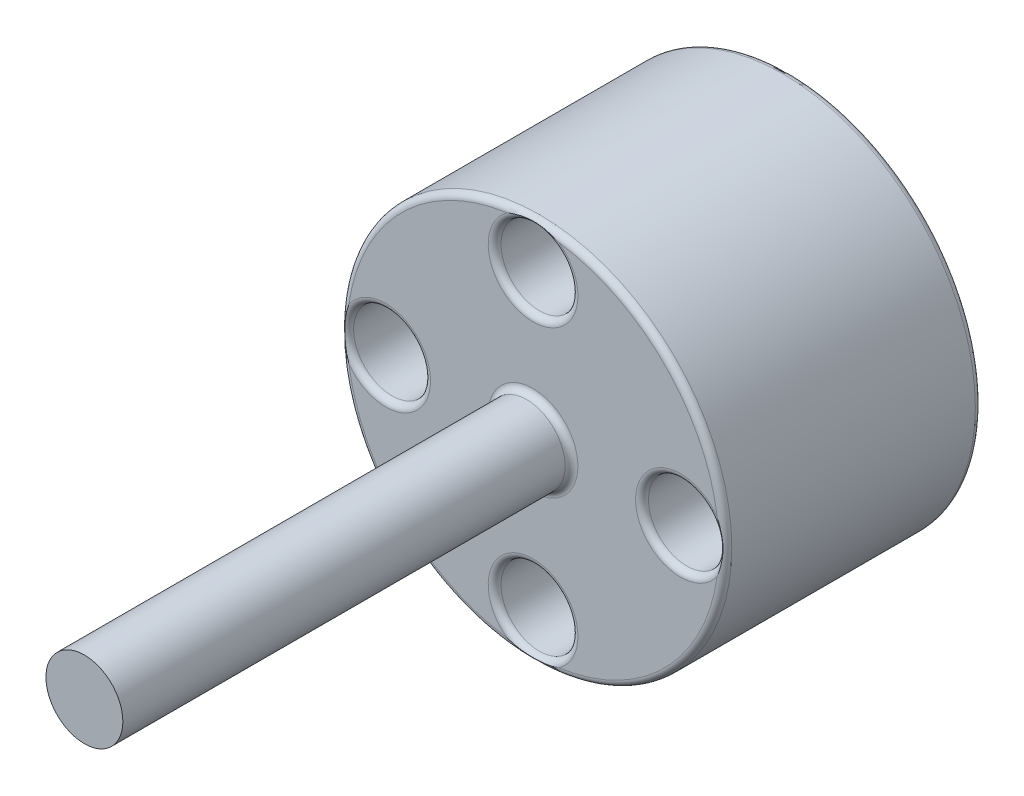
from build123d import *

# Parameters (mm, degrees)
SKETCH1_R                = 1.5
BOSS_EXTRUDE1_DEPTH      = 2
SKETCH3_R                = 0.3
CUT_EXTRUDE2_DEPTH       = 3
BOSS_EXTRUDE2_DEPTH      = 3.5
BOSS_EXTRUDE2_DEPTH_BACK = 2
SKETCH2_R                = 0.3
FILLET1_R                = 0.05


with BuildPart() as part:
    # Sketch1 → Boss-Extrude1 (new body)
    with BuildSketch(Plane.XY):
        Circle(SKETCH1_R)
    extrude(amount=BOSS_EXTRUDE1_DEPTH)

    # Sketch3 → Cut-Extrude2 (cut)
    with BuildSketch(Plane.XY.offset(2)):
        with Locations((0, 1.15)):
            Circle(SKETCH3_R)
        with Locations((1.15, 0)):
            Circle(SKETCH3_R)
        with Locations((0, -1.15)):
            Circle(SKETCH3_R)
        with Locations((-1.15, 0)):
            Circle(SKETCH3_R)
    extrude(amount=-CUT_EXTRUDE2_DEPTH, mode=Mode.SUBTRACT)

    # Sketch2 → Boss-Extrude2 (add, two sides: drawn at the far end of the back side and taken through both)
    with BuildSketch(Plane.XY.offset(2).offset(-BOSS_EXTRUDE2_DEPTH_BACK)):
        Circle(SKETCH2_R)
    extrude(amount=BOSS_EXTRUDE2_DEPTH + BOSS_EXTRUDE2_DEPTH_BACK)

    # Fillet1
    # the kernel refuses this fillet: 0.05 mm, written as the material it adds along each edge
    with BuildSketch(Plane(origin=(0, 0, 2), x_dir=(1, 0, 0), z_dir=(0, -1, 0))) as fillet1_piece_1:
        with BuildLine():
            CenterArc((0.3 + FILLET1_R, FILLET1_R), FILLET1_R, 180, 90)
            Line((0.3, FILLET1_R), (0.3, 0))
            Line((0.3, 0), (0.3 + FILLET1_R, 0))
        make_face()
    revolve(axis=Axis((0, 0, 2), (0, 0, 1)))
    # the kernel refuses this fillet: 0.05 mm, written as the material it takes off along each edge
    with BuildSketch(Plane(origin=(-1.15, 0, 0), x_dir=(1, 0, 0), z_dir=(0, -1, 0))) as fillet1_2_piece_1:
        with BuildLine():
            CenterArc((0.3 + FILLET1_R, FILLET1_R), FILLET1_R, 180, 90)
            Line((0.3, FILLET1_R), (0.3, 0))
            Line((0.3, 0), (0.3 + FILLET1_R, 0))
        make_face()
    revolve(axis=Axis((-1.15, 0, 0), (0, 0, 1)), mode=Mode.SUBTRACT)
    with BuildSketch(Plane(origin=(-1.15, 0, 2), x_dir=(1, 0, 0), z_dir=(0, -1, 0))) as fillet1_2_piece_2:
        with BuildLine():
            CenterArc((0.3 + FILLET1_R, -FILLET1_R), FILLET1_R, 90, 90)
            Line((0.3, -FILLET1_R), (0.3, 0))
            Line((0.3, 0), (0.3 + FILLET1_R, 0))
        make_face()
    revolve(axis=Axis((-1.15, 0, 2), (0, 0, 1)), mode=Mode.SUBTRACT)
    with BuildSketch(Plane(origin=(1.15, 0, 0), x_dir=(1, 0, 0), z_dir=(0, -1, 0))) as fillet1_2_piece_3:
        with BuildLine():
            CenterArc((0.3 + FILLET1_R, FILLET1_R), FILLET1_R, 180, 90)
            Line((0.3, FILLET1_R), (0.3, 0))
            Line((0.3, 0), (0.3 + FILLET1_R, 0))
        make_face()
    revolve(axis=Axis((1.15, 0, 0), (0, 0, 1)), mode=Mode.SUBTRACT)
    with BuildSketch(Plane(origin=(1.15, 0, 2), x_dir=(1, 0, 0), z_dir=(0, -1, 0))) as fillet1_2_piece_4:
        with BuildLine():
            CenterArc((0.3 + FILLET1_R, -FILLET1_R), FILLET1_R, 90, 90)
            Line((0.3, -FILLET1_R), (0.3, 0))
            Line((0.3, 0), (0.3 + FILLET1_R, 0))
        make_face()
    revolve(axis=Axis((1.15, 0, 2), (0, 0, 1)), mode=Mode.SUBTRACT)
    with BuildSketch(Plane(origin=(0, 0, 0), x_dir=(1, 0, 0), z_dir=(0, -1, 0))) as fillet1_2_piece_5:
        with BuildLine():
            CenterArc((1.5 - FILLET1_R, FILLET1_R), FILLET1_R, 270, 90)
            Line((1.5 - FILLET1_R, 0), (1.5, 0))
            Line((1.5, 0), (1.5, FILLET1_R))
        make_face()
    revolve(axis=Axis((0, 0, 0), (0, 0, 1)), mode=Mode.SUBTRACT)
    with BuildSketch(Plane(origin=(0, -1.15, 0), x_dir=(1, 0, 0), z_dir=(0, -1, 0))) as fillet1_2_piece_6:
        with BuildLine():
            CenterArc((0.3 + FILLET1_R, FILLET1_R), FILLET1_R, 180, 90)
            Line((0.3, FILLET1_R), (0.3, 0))
            Line((0.3, 0), (0.3 + FILLET1_R, 0))
        make_face()
    revolve(axis=Axis((0, -1.15, 0), (0, 0, 1)), mode=Mode.SUBTRACT)
    with BuildSketch(Plane(origin=(0, -1.15, 2), x_dir=(1, 0, 0), z_dir=(0, -1, 0))) as fillet1_2_piece_7:
        with BuildLine():
            CenterArc((0.3 + FILLET1_R, -FILLET1_R), FILLET1_R, 90, 90)
            Line((0.3, -FILLET1_R), (0.3, 0))
            Line((0.3, 0), (0.3 + FILLET1_R, 0))
        make_face()
    revolve(axis=Axis((0, -1.15, 2), (0, 0, 1)), mode=Mode.SUBTRACT)
    with BuildSketch(Plane(origin=(0, 0, 2), x_dir=(1, 0, 0), z_dir=(0, -1, 0))) as fillet1_2_piece_8:
        with BuildLine():
            CenterArc((1.5 - FILLET1_R, -FILLET1_R), FILLET1_R, 0, 90)
            Line((1.5 - FILLET1_R, 0), (1.5, 0))
            Line((1.5, 0), (1.5, -FILLET1_R))
        make_face()
    revolve(axis=Axis((0, 0, 2), (0, 0, 1)), mode=Mode.SUBTRACT)
    with BuildSketch(Plane(origin=(0, 1.15, 0), x_dir=(1, 0, 0), z_dir=(0, -1, 0))) as fillet1_2_piece_9:
        with BuildLine():
            CenterArc((0.3 + FILLET1_R, FILLET1_R), FILLET1_R, 180, 90)
            Line((0.3, FILLET1_R), (0.3, 0))
            Line((0.3, 0), (0.3 + FILLET1_R, 0))
        make_face()
    revolve(axis=Axis((0, 1.15, 0), (0, 0, 1)), mode=Mode.SUBTRACT)
    with BuildSketch(Plane(origin=(0, 1.15, 2), x_dir=(1, 0, 0), z_dir=(0, -1, 0))) as fillet1_2_piece_10:
        with BuildLine():
            CenterArc((0.3 + FILLET1_R, -FILLET1_R), FILLET1_R, 90, 90)
            Line((0.3, -FILLET1_R), (0.3, 0))
            Line((0.3, 0), (0.3 + FILLET1_R, 0))
        make_face()
    revolve(axis=Axis((0, 1.15, 2), (0, 0, 1)), mode=Mode.SUBTRACT)


solid = part.part
